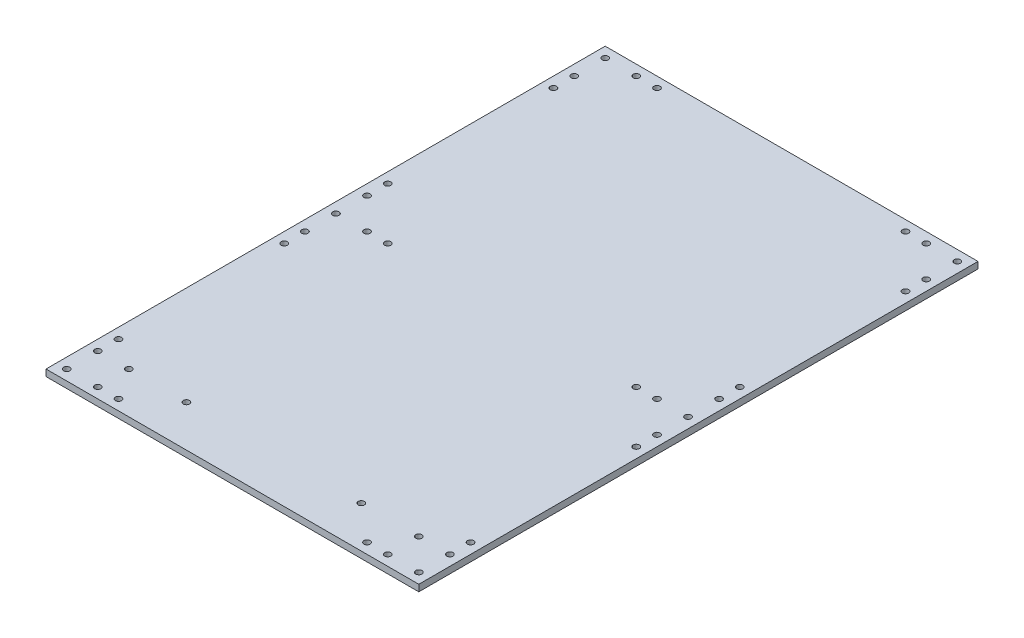
from build123d import *

# Parameters (mm, degrees)
SKETCH1_W             = 360
SKETCH1_H             = 540
BOSS_EXTRUDE1_DEPTH   = 6.35
F_6_0MM_DOWEL_HOLE3_D = 6
F_6_0MM_DOWEL_HOLE2_D = 6
F_6_0MM_DOWEL_HOLE1_D = 6


with BuildPart() as part:
    # Sketch1 → Boss-Extrude1 (new body)
    with BuildSketch(Plane(origin=(0, 0, 0), x_dir=(1, 0, 0), z_dir=(0, 1, 0))):
        with Locations((180, 270)):
            Rectangle(SKETCH1_W, SKETCH1_H)
    extrude(amount=BOSS_EXTRUDE1_DEPTH)

    # Ø6.0mm Dowel Hole3 (through all)
    with Locations(Plane(origin=(0, 6.35, 0), x_dir=(1, 0, 0), z_dir=(0, 1, 0))):
        with Locations((40, 40), (95.5625, 40), (264.4375, 40), (320, 40)):
            Hole(F_6_0MM_DOWEL_HOLE3_D / 2)

    # Ø6.0mm Dowel Hole2 (through all)
    with Locations(Plane(origin=(0, 6.35, 0), x_dir=(1, 0, 0), z_dir=(0, 1, 0))):
        with Locations((40, 10), (10, 40), (320, 10), (350, 40), (10, 240), (40, 270), (10, 300), (350, 240), (320, 270), (350, 300), (10, 500), (40, 530), (320, 530), (350, 500), (10, 480), (60, 530), (300, 530), (350, 480), (350, 320), (300, 270), (350, 220), (10, 220), (60, 270), (10, 320), (10, 60), (60, 10), (300, 10), (350, 60)):
            Hole(F_6_0MM_DOWEL_HOLE2_D / 2)

    # Ø6.0mm Dowel Hole1 (through all)
    with Locations(Plane(origin=(0, 6.35, 0), x_dir=(1, 0, 0), z_dir=(0, 1, 0))):
        with Locations((10, 10), (350, 10), (350, 530), (10, 530), (10, 270), (350, 270)):
            Hole(F_6_0MM_DOWEL_HOLE1_D / 2)


solid = part.part
